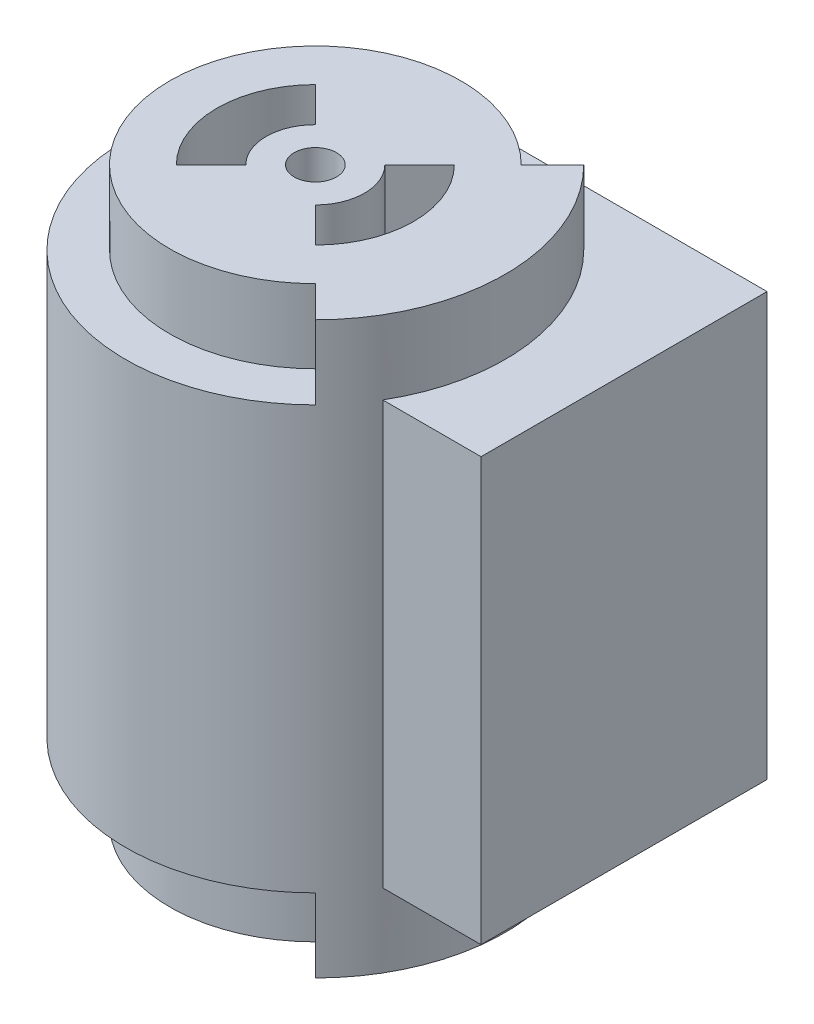
from build123d import *

# Parameters (mm, degrees)
BOSS_EXTRUDE1_DEPTH = 43
BOSS_EXTRUDE2_START = 15
BOSS_EXTRUDE2_DEPTH = 15
SKETCH6_R           = 4.3
CUT_EXTRUDE4_DEPTH  = 88.729655833


with BuildPart() as part:
    # Sketch1 → Boss-Extrude1 (new body)
    with BuildSketch(Plane(origin=(0, 0, 0), x_dir=(1, 0, 0), z_dir=(0, 1, 0))):
        with BuildLine():
            Line((0, 38.625), (53.297297188, 38.625))
            Line((53.297297188, 38.625), (53.297297188, -19.575))
            Line((53.297297188, -19.575), (33.297297188, -19.575))
            ThreePointArc((33.297297188, -19.575), (-33.525922806, -19.180800948), (0, 38.625))
        make_face()
    boss_extrude1 = extrude(amount=BOSS_EXTRUDE1_DEPTH)

    # Sketch4 → Boss-Extrude2 (add)
    with BuildSketch(Plane.XZ.offset(BOSS_EXTRUDE2_START)):
        with BuildLine():
            Line((20.948038393, 20.948038393), (27.311999423, 27.311999423))
            ThreePointArc((27.311999423, 27.311999423), (38.625, 0), (27.311999423, -27.311999423))
            Line((27.311999423, -27.311999423), (20.948038393, -20.948038393))
            ThreePointArc((20.948038393, -20.948038393), (-29.625, 0), (20.948038393, 20.948038393))
        make_face()
    boss_extrude2 = extrude(amount=-BOSS_EXTRUDE2_DEPTH)

    # Sketch6 → Cut-Extrude4 (cut, symmetric)
    with BuildSketch(Plane.XZ.offset(15)):
        Circle(SKETCH6_R)
        with BuildLine():
            Line((7.071067812, 7.071067812), (14.142135624, 14.142135624))
            ThreePointArc((14.142135624, 14.142135624), (20, 0), (14.142135624, -14.142135624))
            Line((14.142135624, -14.142135624), (7.071067812, -7.071067812))
            ThreePointArc((7.071067812, -7.071067812), (10, 0), (7.071067812, 7.071067812))
        make_face()
        with BuildLine():
            Line((-7.071067812, -7.071067812), (-14.142135624, -14.142135624))
            ThreePointArc((-14.142135624, -14.142135624), (-20, 0), (-14.142135624, 14.142135624))
            Line((-14.142135624, 14.142135624), (-7.071067812, 7.071067812))
            ThreePointArc((-7.071067812, 7.071067812), (-10, 0), (-7.071067812, -7.071067812))
        make_face()
    cut_extrude4 = extrude(amount=CUT_EXTRUDE4_DEPTH, both=True, mode=Mode.SUBTRACT)

    # Mirror1: Boss-Extrude1, Boss-Extrude2, Cut-Extrude4 across plane
    add(boss_extrude1.mirror(Plane.ZX.offset(43)))
    add(boss_extrude2.mirror(Plane.ZX.offset(43)))
    add(cut_extrude4.mirror(Plane.ZX.offset(43)), mode=Mode.SUBTRACT)


solid = part.part
